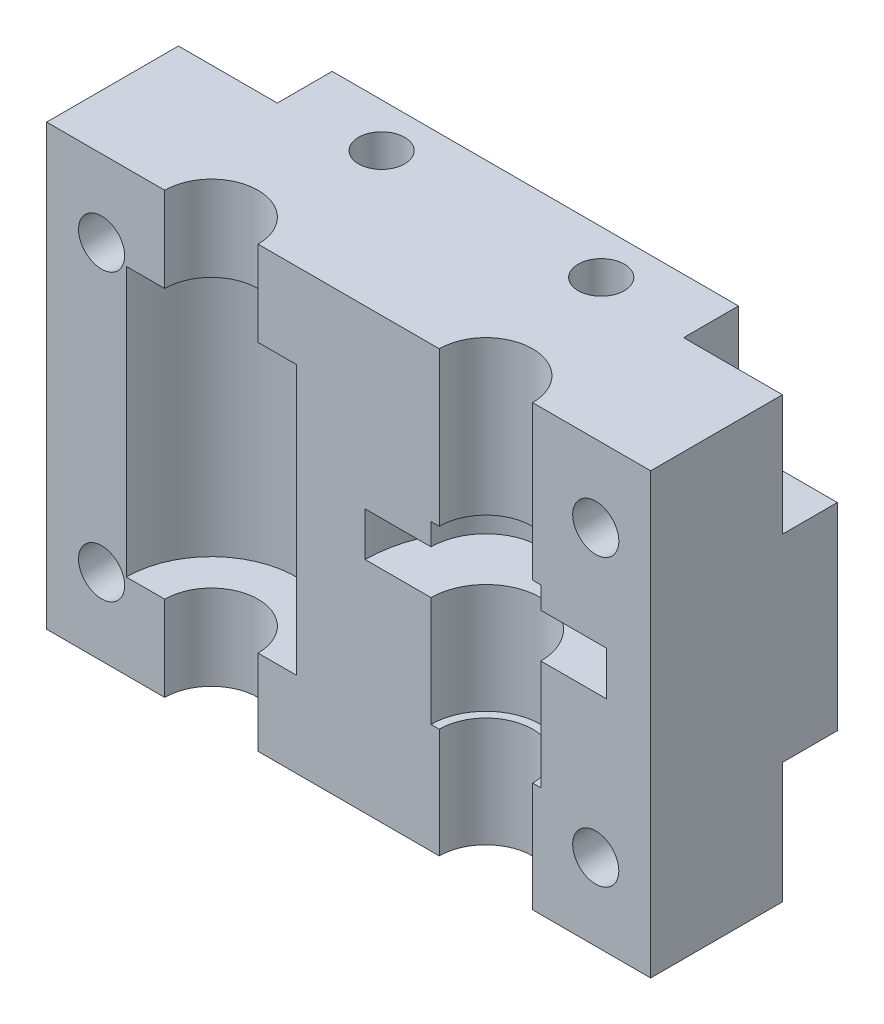
from build123d import *
from build123d.topology import SkipClean

# Parameters (mm, degrees)
ESQUISSE1_W                  = 55
ESQUISSE1_H                  = 45
BOSS_EXTRU_1_DEPTH           = 12
ESQUISSE2_R                  = 4.25
ENL_V_MAT_EXTRU_1_DEPTH      = 55.085580333
ENL_V_MAT_EXTRU_2_DEPTH      = 12.25
ENL_V_MAT_EXTRU_2_DEPTH_BACK = 12.25
ESQUISSE3_R                  = 7.75
ESQUISSE9_W                  = 61.062756781
ESQUISSE9_H                  = 12.22812859
ESQUISSE9_W_2                = 59.427147224
ESQUISSE9_H_2                = 8.100161614
ENL_V_MAT_EXTRU_7_DEPTH      = 31
SKETCH1_W                    = 55
SKETCH1_H                    = 36
BOSS_EXTRUDE1_DEPTH          = 5
SKETCH2_R                    = 2.1
CUT_EXTRUDE1_DEPTH           = 38.003378224
SKETCH3_R                    = 4
CUT_EXTRUDE2_DEPTH           = 10
CUT_EXTRUDE3_DEPTH           = 5
SKETCH5_R                    = 2.1
CUT_EXTRUDE4_DEPTH           = 47.864165415
BOSS_EXTRUDE4_START          = 2
SKETCH7_R                    = 2.1
BOSS_EXTRUDE4_DEPTH          = 2
SKETCH8_R                    = 2.1
BOSS_EXTRUDE5_DEPTH          = 2
SKETCH9_W                    = 7
SKETCH9_H                    = 3.2
CUT_EXTRUDE6_DEPTH           = 8


with BuildPart() as part:
    # Esquisse1 → Boss.-Extru.1 (new body)
    with BuildSketch(Plane.XY):
        Rectangle(ESQUISSE1_W, ESQUISSE1_H)
    extrude(amount=BOSS_EXTRU_1_DEPTH)

    # Esquisse2 → Enlèv. mat.-Extru.1 (cut, through all)
    with BuildSketch(Plane(origin=(0, 22.5, 0), x_dir=(1, 0, 0), z_dir=(0, 1, 0))):
        with Locations((-12.5, -12)):
            Circle(ESQUISSE2_R)
        with Locations((12.5, -12)):
            Circle(ESQUISSE2_R)
    extrude(amount=-ENL_V_MAT_EXTRU_1_DEPTH, mode=Mode.SUBTRACT)

    # Esquisse3 → Enlèv. mat.-Extru.2 (cut, two sides: drawn at the far end of the back side and taken through both)
    with BuildSketch(Plane(origin=(0, 0, 0), x_dir=(1, 0, 0), z_dir=(0, 1, 0)).offset(-ENL_V_MAT_EXTRU_2_DEPTH_BACK)):
        with Locations((-12.5, -12)):
            Circle(ESQUISSE3_R)
    extrude(amount=ENL_V_MAT_EXTRU_2_DEPTH + ENL_V_MAT_EXTRU_2_DEPTH_BACK, mode=Mode.SUBTRACT)

    # Esquisse9 → Enlèv. mat.-Extru.7 (cut)
    with BuildSketch(Plane.XY.offset(12)):
        with Locations((-0.389430846, -24.114064295)):
            Rectangle(ESQUISSE9_W, ESQUISSE9_H)
        with Locations((1.674552641, 22.050080807)):
            Rectangle(ESQUISSE9_W_2, ESQUISSE9_H_2)
    extrude(amount=-ENL_V_MAT_EXTRU_7_DEPTH, mode=Mode.SUBTRACT)

    # Sketch1 → Boss-Extrude1 (add)
    with BuildSketch(Plane(origin=(0, 0, 0), x_dir=(-1, 0, 0), z_dir=(0, 0, -1))):
        Rectangle(SKETCH1_W, SKETCH1_H)
    extrude(amount=BOSS_EXTRUDE1_DEPTH)

    # Sketch2 → Cut-Extrude1 (cut, through all)
    with BuildSketch(Plane.XY.offset(12)):
        with Locations((-22.5, 13)):
            Circle(SKETCH2_R)
        with Locations((22.5, 13)):
            Circle(SKETCH2_R)
        with Locations((22.5, -13)):
            Circle(SKETCH2_R)
        with Locations((-22.5, -13)):
            Circle(SKETCH2_R)
    extrude(amount=-CUT_EXTRUDE1_DEPTH, mode=Mode.SUBTRACT)

    # Sketch3 → Cut-Extrude2 (cut)
    with BuildSketch(Plane(origin=(0, 0, -5), x_dir=(-1, 0, 0), z_dir=(0, 0, -1))):
        with Locations((-22.5, 13)):
            Circle(SKETCH3_R)
        with Locations((22.5, 13)):
            Circle(SKETCH3_R)
        with Locations((22.5, -13)):
            Circle(SKETCH3_R)
        with Locations((-22.5, -13)):
            Circle(SKETCH3_R)
    extrude(amount=-CUT_EXTRUDE2_DEPTH, mode=Mode.SUBTRACT)

    # Sketch4 → Cut-Extrude3 (cut)
    with BuildSketch(Plane(origin=(0, 0, -5), x_dir=(-1, 0, 0), z_dir=(0, 0, -1))):
        with BuildLine():
            Line((-18.5, 13), (-18.5, 18))
            Line((-18.5, 18), (-27.5, 18))
            Line((-27.5, 18), (-27.5, 9))
            Line((-27.5, 9), (-22.5, 9))
            ThreePointArc((-22.5, 9), (-25.328427125, 15.828427125), (-18.5, 13))
        make_face()
        with BuildLine():
            Line((-22.5, -9), (-27.5, -9))
            Line((-27.5, -9), (-27.5, -18))
            Line((-27.5, -18), (-18.5, -18))
            Line((-18.5, -18), (-18.5, -13))
            ThreePointArc((-18.5, -13), (-25.328427125, -15.828427125), (-22.5, -9))
        make_face()
        with BuildLine():
            Line((27.5, -18), (27.5, -9))
            Line((27.5, -9), (22.5, -9))
            ThreePointArc((22.5, -9), (25.328427125, -15.828427125), (18.5, -13))
            Line((18.5, -13), (18.5, -18))
            Line((18.5, -18), (27.5, -18))
        make_face()
        with BuildLine():
            Line((27.5, 18), (18.5, 18))
            Line((18.5, 18), (18.5, 13))
            ThreePointArc((18.5, 13), (25.328427125, 15.828427125), (22.5, 9))
            Line((22.5, 9), (27.5, 9))
            Line((27.5, 9), (27.5, 18))
        make_face()
    extrude(amount=-CUT_EXTRUDE3_DEPTH, mode=Mode.SUBTRACT)

    # Sketch5 → Cut-Extrude4 (cut, through all)
    with BuildSketch(Plane(origin=(0, 18, 0), x_dir=(1, 0, 0), z_dir=(0, 1, 0))):
        with Locations((-10, 1)):
            Circle(SKETCH5_R)
        with Locations((10, 1)):
            Circle(SKETCH5_R)
    extrude(amount=-CUT_EXTRUDE4_DEPTH, mode=Mode.SUBTRACT)

    # Sketch7 → Boss-Extrude4 (add)
    with SkipClean():  # the faces are left unmerged after this step: merging them gives an invalid solid
        with BuildSketch(Plane(origin=(0, 18, 0), x_dir=(1, 0, 0), z_dir=(0, 1, 0)).offset(BOSS_EXTRUDE4_START)):
            with BuildLine():
                Line((18.5, 5), (-18.5, 5))
                Line((-18.5, 5), (-18.5, 0))
                Line((-18.5, 0), (-27.5, 0))
                Line((-27.5, 0), (-27.5, -12))
                Line((-27.5, -12), (-16.75, -12))
                ThreePointArc((-16.75, -12), (-12.5, -7.75), (-8.25, -12))
                Line((-8.25, -12), (8.25, -12))
                ThreePointArc((8.25, -12), (12.5, -7.75), (16.75, -12))
                Line((16.75, -12), (27.5, -12))
                Line((27.5, -12), (27.5, 0))
                Line((27.5, 0), (18.5, 0))
                Line((18.5, 0), (18.5, 5))
            make_face()
            with Locations((10, 1)):
                Circle(SKETCH7_R, mode=Mode.SUBTRACT)
            with Locations((-10, 1)):
                Circle(SKETCH7_R, mode=Mode.SUBTRACT)
        extrude(amount=-BOSS_EXTRUDE4_DEPTH)
    add(part.part.scale(1), mode=Mode.REPLACE)  # the faces are merged on a copy

    # Sketch8 → Boss-Extrude5 (add)
    with BuildSketch(Plane.XZ.offset(18)):
        with BuildLine():
            Line((-27.5, 0), (-18.5, 0))
            Line((-18.5, 0), (-18.5, -5))
            Line((-18.5, -5), (18.5, -5))
            Line((18.5, -5), (18.5, 0))
            Line((18.5, 0), (27.5, 0))
            Line((27.5, 0), (27.5, 12))
            Line((27.5, 12), (16.75, 12))
            ThreePointArc((16.75, 12), (12.5, 7.75), (8.25, 12))
            Line((8.25, 12), (-8.25, 12))
            ThreePointArc((-8.25, 12), (-12.5, 7.75), (-16.75, 12))
            Line((-16.75, 12), (-27.5, 12))
            Line((-27.5, 12), (-27.5, 0))
        make_face()
        with Locations((10, -1)):
            Circle(SKETCH8_R, mode=Mode.SUBTRACT)
        with Locations((-10, -1)):
            Circle(SKETCH8_R, mode=Mode.SUBTRACT)
    extrude(amount=BOSS_EXTRUDE5_DEPTH)

    # Sketch9 → Cut-Extrude6 (cut)
    with BuildSketch(Plane(origin=(0, 0, -5), x_dir=(-1, 0, 0), z_dir=(0, 0, -1))):
        with Locations((-10, 14.4)):
            Rectangle(SKETCH9_W, SKETCH9_H)
        with Locations((10, 14.4)):
            Rectangle(SKETCH9_W, SKETCH9_H)
        with Locations((10, -14.4)):
            Rectangle(SKETCH9_W, SKETCH9_H)
        with Locations((-10, -14.4)):
            Rectangle(SKETCH9_W, SKETCH9_H)
    extrude(amount=-CUT_EXTRUDE6_DEPTH, mode=Mode.SUBTRACT)

    # Sketch10 → Cut-Revolve1 (revolve, cut)
    with BuildSketch(Plane.XY.offset(12)):
        Polygon((12.5, -10), (17.5, -10), (17.5, 0), (23.5, 0), (23.5, 4), (17.5, 4), (17.5, 6), (12.5, 6), align=None)
    revolve(axis=Axis((12.5, 20, 12), (0, -1, 0)), mode=Mode.SUBTRACT)


solid = part.part
